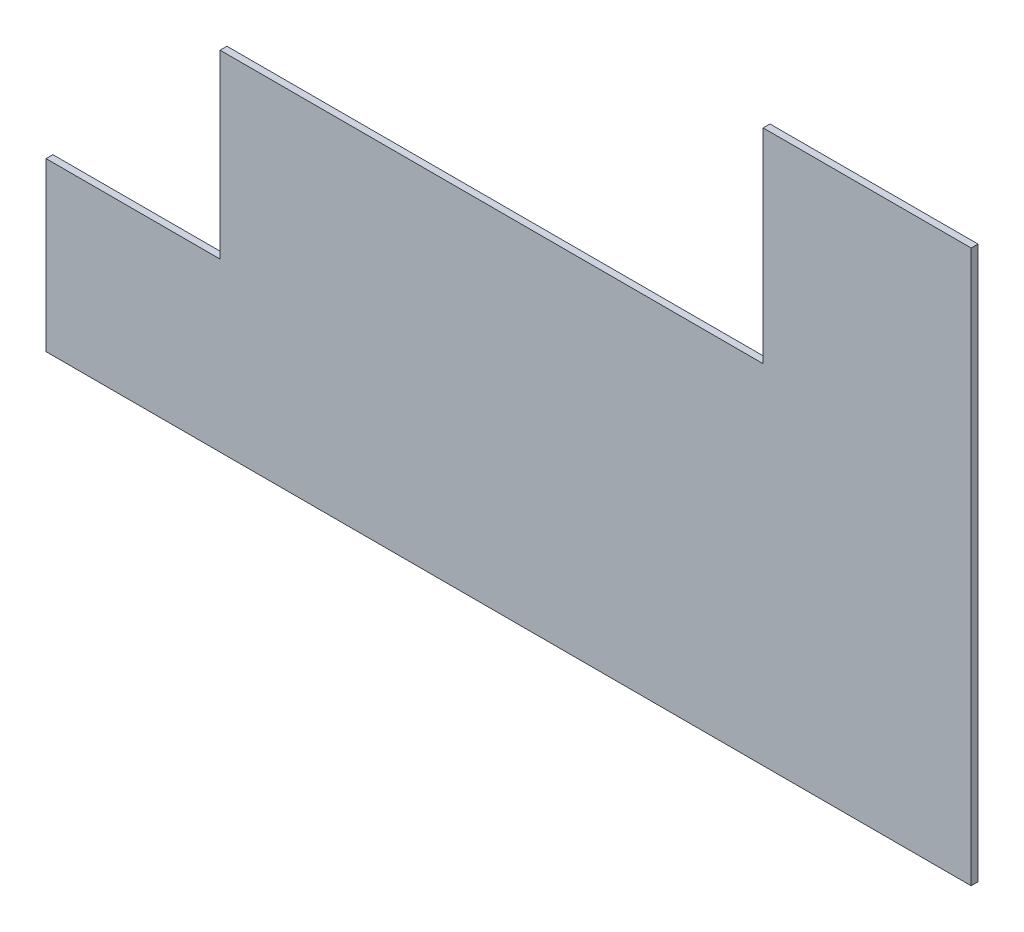
from build123d import *

# Parameters (mm, degrees)
TABAN_FLAN_1_DEPTH         = 25
KES_EKSTR_ZYON1_DEPTH      = 6508.676543898
KES_EKSTR_ZYON1_DEPTH_BACK = 6508.676543898
IZIM7_W                    = 1400
IZIM7_H                    = 1895
IZIM7_W_2                  = 310
IZIM7_H_2                  = 495
KES_EKSTR_ZYON2_DEPTH      = 6508.676543898
KES_EKSTR_ZYON2_DEPTH_BACK = 6508.676543898
IZIM8_W                    = 292
IZIM8_H                    = 2515
KES_EKSTR_ZYON3_DEPTH      = 6240.38698912
KES_EKSTR_ZYON3_DEPTH_BACK = 6240.38698912
IZIM10_W                   = 2900
IZIM10_H                   = 350
KES_EKSTR_ZYON4_DEPTH      = 6240.38698912
KES_EKSTR_ZYON4_DEPTH_BACK = 6240.38698912
KES_EKSTR_ZYON5_DEPTH      = 6191.05856192
KES_EKSTR_ZYON5_DEPTH_BACK = 6191.05856192
IZIM12_W                   = 5
IZIM12_H                   = 615
KES_EKSTR_ZYON6_DEPTH      = 6191.05856192
KES_EKSTR_ZYON6_DEPTH_BACK = 6191.05856192
IZIM13_W                   = 55
IZIM13_H                   = 2385
KES_EKSTR_ZYON7_DEPTH      = 6140.360715905
KES_EKSTR_ZYON7_DEPTH_BACK = 6140.360715905
KES_EKSTR_ZYON8_DEPTH      = 6140.360715905
KES_EKSTR_ZYON8_DEPTH_BACK = 6140.360715905
IZIM16_W                   = 190
IZIM16_H                   = 370
IZIM16_W_2                 = 620
IZIM16_H_2                 = 610


# Sheet-metal steps are written as plain solids
with BuildPart() as part:
    # Çizim1 → Taban-Flanş1 (new body)
    with BuildSketch(Plane.XY):
        Polygon((0, 0), (0, 1895), (2935, 1895), (2935, 2020), (4900, 2020), (4900, 2515), (6002, 2515), (6002, 0), align=None)
    extrude(amount=-TABAN_FLAN_1_DEPTH)

    # Çizim7 → Kes-Ekstrüzyon1 (cut, two sides: drawn at the far end of the back side and taken through both)
    with BuildSketch(Plane.XY.offset(-KES_EKSTR_ZYON1_DEPTH_BACK)):
        with Locations((700, 947.5)):
            Rectangle(IZIM7_W, IZIM7_H)
        with Locations((5055, 2267.5)):
            Rectangle(IZIM7_W_2, IZIM7_H_2)
    extrude(amount=KES_EKSTR_ZYON1_DEPTH + KES_EKSTR_ZYON1_DEPTH_BACK, mode=Mode.SUBTRACT)

    # Çizim8 → Kes-Ekstrüzyon2 (cut, two sides: drawn at the far end of the back side and taken through both)
    with BuildSketch(Plane.XY.offset(-KES_EKSTR_ZYON2_DEPTH_BACK)):
        with Locations((5856, 1257.5)):
            Rectangle(IZIM8_W, IZIM8_H)
    extrude(amount=KES_EKSTR_ZYON2_DEPTH + KES_EKSTR_ZYON2_DEPTH_BACK, mode=Mode.SUBTRACT)

    # Çizim10 → Kes-Ekstrüzyon3 (cut, two sides: drawn at the far end of the back side and taken through both)
    with BuildSketch(Plane.XY.offset(-KES_EKSTR_ZYON3_DEPTH_BACK)):
        with Locations((2850, 1845)):
            Rectangle(IZIM10_W, IZIM10_H)
    extrude(amount=KES_EKSTR_ZYON3_DEPTH + KES_EKSTR_ZYON3_DEPTH_BACK, mode=Mode.SUBTRACT)

    # Çizim11 → Kes-Ekstrüzyon4 (cut, two sides: drawn at the far end of the back side and taken through both)
    with BuildSketch(Plane.XY.offset(-KES_EKSTR_ZYON4_DEPTH_BACK)):
        Polygon((4300, 1670), (4530, 1670), (4530, 2020), (5210, 2020), (5210, 2390), (5710, 2390), (5778.630385148, 2406.496682207), (5749.815338653, 2697.266696836), (5189.231706845, 2697.266696836), (4530, 2199.552257381), (4300, 2199.552257381), align=None)
    extrude(amount=KES_EKSTR_ZYON4_DEPTH + KES_EKSTR_ZYON4_DEPTH_BACK, mode=Mode.SUBTRACT)

    # Çizim12 → Kes-Ekstrüzyon5 (cut, two sides: drawn at the far end of the back side and taken through both)
    with BuildSketch(Plane.XY.offset(-KES_EKSTR_ZYON5_DEPTH_BACK)):
        Polygon((2660, 1670), (1400, 1670), (1400, 615), (1405, 615), (2660, 615), align=None)
        with Locations((1402.5, 307.5)):
            Rectangle(IZIM12_W, IZIM12_H)
    extrude(amount=KES_EKSTR_ZYON5_DEPTH + KES_EKSTR_ZYON5_DEPTH_BACK, mode=Mode.SUBTRACT)

    # Çizim13 → Kes-Ekstrüzyon6 (cut, two sides: drawn at the far end of the back side and taken through both)
    with BuildSketch(Plane.XY.offset(-KES_EKSTR_ZYON6_DEPTH_BACK)):
        with Locations((5682.5, 1197.5)):
            Rectangle(IZIM13_W, IZIM13_H)
        Polygon((1405, 0), (5710, 0), (5710, 5), (5655, 5), (1405, 5), align=None)
    extrude(amount=KES_EKSTR_ZYON6_DEPTH + KES_EKSTR_ZYON6_DEPTH_BACK, mode=Mode.SUBTRACT)

    # Çizim15 → Kes-Ekstrüzyon7 (cut, two sides: drawn at the far end of the back side and taken through both)
    with BuildSketch(Plane.XY.offset(-KES_EKSTR_ZYON7_DEPTH_BACK)):
        Polygon((2660, 1275), (4641, 1275), (4641, 2020), (5020.0077847, 2245.071458559), (4183.340521497, 2599.685397929), (2166.473741327, 1968.029318425), align=None)
    extrude(amount=KES_EKSTR_ZYON7_DEPTH + KES_EKSTR_ZYON7_DEPTH_BACK, mode=Mode.SUBTRACT)

    # Çizim16 → Kes-Ekstrüzyon8 (cut, two sides: drawn at the far end of the back side and taken through both)
    with BuildSketch(Plane.XY.offset(-KES_EKSTR_ZYON8_DEPTH_BACK)):
        Polygon((5655, 5), (5655, 2390), (5400, 2390), (5400, 2020), (5400, 5), align=None)
        with Locations((5305, 2205)):
            Rectangle(IZIM16_W, IZIM16_H)
        with Locations((1715, 310)):
            Rectangle(IZIM16_W_2, IZIM16_H_2)
    extrude(amount=KES_EKSTR_ZYON8_DEPTH + KES_EKSTR_ZYON8_DEPTH_BACK, mode=Mode.SUBTRACT)


solid = part.part
